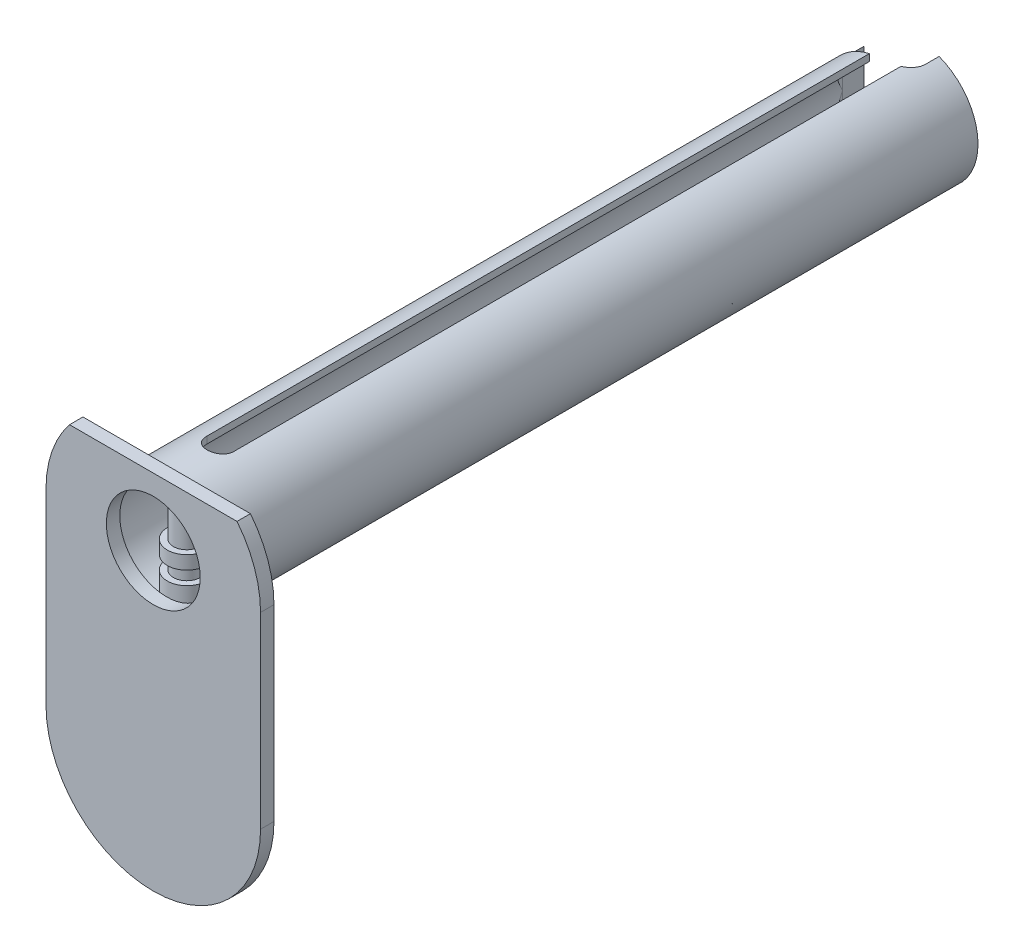
from build123d import *

# Parameters (mm, degrees)
ESQUISSE1_R                    = 4.5
ESQUISSE1_R_2                  = 4
BOSS_EXTRU_1_DEPTH             = 28
BOSS_EXTRU_2_REACH             = 30.714
ESQUISSE2_R                    = 1
ESQUISSE2_R_2                  = 0.5
BOSS_EXTRU_2_DIRECTION_2_REACH = 30.714
ENL_V_MAT_EXTRU_1_DEPTH        = 29.714108128
ENL_V_MAT_EXTRU_1_DEPTH_BACK   = 29.714108128
ESQUISSE4_R                    = 3.5
BOSS_EXTRU_3_DEPTH             = 1
ESQUISSE6_OUTSIDE_W            = 31.274
ESQUISSE6_OUTSIDE_H            = 45.274
ESQUISSE6_OUTSIDE_W_2          = 16
ESQUISSE6_OUTSIDE_H_2          = 27
ENL_V_MAT_EXTRU_2_DEPTH        = 62.619802105
BOSS_EXTRU_6_START             = -1.5
ESQUISSE7_R                    = 1.45
BOSS_EXTRU_6_DEPTH             = 1
BOSS_EXTRU_7_REACH             = 39.404
BOSS_EXTRU_7_START             = 1
ESQUISSE8_R                    = 1.45
ENL_V_MAT_EXTRU_3_DEPTH        = 38.269290307
ENL_V_MAT_EXTRU_3_DEPTH_BACK   = 38.269290307


with BuildPart() as part:
    # Esquisse1 → Boss.-Extru.1 (new, symmetric)
    with BuildSketch(Plane.XY):
        Circle(ESQUISSE1_R)
        Circle(ESQUISSE1_R_2, mode=Mode.SUBTRACT)
    extrude(amount=BOSS_EXTRU_1_DEPTH, both=True)

    # Esquisse2 → Boss.-Extru.2 (add, up to next)
    with BuildSketch(Plane(origin=(0, 0, 0), x_dir=(1, 0, 0), z_dir=(0, 1, 0)), mode=Mode.PRIVATE) as boss_extru_2_sk1:
        with Locations((0, -26.5)):
            Circle(ESQUISSE2_R)
    boss_extru_2_tool1 = extrude(boss_extru_2_sk1.sketch, amount=BOSS_EXTRU_2_REACH, mode=Mode.PRIVATE) - part.part
    # Esquisse2 → Boss.-Extru.2 (add, up to next)
    with BuildSketch(Plane(origin=(0, 0, 0), x_dir=(1, 0, 0), z_dir=(0, 1, 0)), mode=Mode.PRIVATE) as boss_extru_2_sk2:
        with Locations((3, 26.5)):
            Circle(ESQUISSE2_R_2)
    boss_extru_2_tool2 = extrude(boss_extru_2_sk2.sketch, amount=BOSS_EXTRU_2_REACH, mode=Mode.PRIVATE) - part.part
    add(boss_extru_2_tool1.solids().sort_by_distance((0, 0, 26.5))[0])
    add(boss_extru_2_tool2.solids().sort_by_distance((3, 0, -26.5))[0])

    # Esquisse2 → Boss.-Extru.2 direction 2 (add, up to next)
    with BuildSketch(Plane(origin=(0, 0, 0), x_dir=(1, 0, 0), z_dir=(0, 1, 0)), mode=Mode.PRIVATE) as boss_extru_2_direction_2_sk1:
        with Locations((0, -26.5)):
            Circle(ESQUISSE2_R)
    boss_extru_2_direction_2_tool1 = extrude(boss_extru_2_direction_2_sk1.sketch, amount=-BOSS_EXTRU_2_DIRECTION_2_REACH, mode=Mode.PRIVATE) - part.part
    # Esquisse2 → Boss.-Extru.2 direction 2 (add, up to next)
    with BuildSketch(Plane(origin=(0, 0, 0), x_dir=(1, 0, 0), z_dir=(0, 1, 0)), mode=Mode.PRIVATE) as boss_extru_2_direction_2_sk2:
        with Locations((3, 26.5)):
            Circle(ESQUISSE2_R_2)
    boss_extru_2_direction_2_tool2 = extrude(boss_extru_2_direction_2_sk2.sketch, amount=-BOSS_EXTRU_2_DIRECTION_2_REACH, mode=Mode.PRIVATE) - part.part
    add(boss_extru_2_direction_2_tool1.solids().sort_by_distance((0, 0, 26.5))[0])
    add(boss_extru_2_direction_2_tool2.solids().sort_by_distance((3, 0, -26.5))[0])

    # Esquisse3 → Enlèv. mat.-Extru.1 (cut, two sides: drawn at the far end of the back side and taken through both)
    with BuildSketch(Plane(origin=(0, 0, 0), x_dir=(1, 0, 0), z_dir=(0, 1, 0)).offset(-ENL_V_MAT_EXTRU_1_DEPTH_BACK)):
        with BuildLine():
            Line((1, 28), (1, -24))
            ThreePointArc((1, -24), (0, -25), (-1, -24))
            Line((-1, -24), (-1, 28))
            ThreePointArc((-1, 28), (0, 29), (1, 28))
        make_face()
    extrude(amount=ENL_V_MAT_EXTRU_1_DEPTH + ENL_V_MAT_EXTRU_1_DEPTH_BACK, mode=Mode.SUBTRACT)

    # Esquisse4 → Boss.-Extru.3 (add)
    with BuildSketch(Plane.XY.offset(28)):
        with BuildLine():
            Line((8, 0), (8, -14))
            ThreePointArc((8, -14), (0, -22), (-8, -14))
            Line((-8, -14), (-8, 0))
            ThreePointArc((-8, 0), (0, 8), (8, 0))
        make_face()
        Circle(ESQUISSE4_R, mode=Mode.SUBTRACT)
    extrude(amount=BOSS_EXTRU_3_DEPTH)

    # Esquisse6 outside → Enlèv. mat.-Extru.2 (cut, through all)
    with BuildSketch(Plane.XY.offset(29)):
        with Locations((0, -7)):
            Rectangle(ESQUISSE6_OUTSIDE_W, ESQUISSE6_OUTSIDE_H)
        with Locations((0, -8.5)):
            Rectangle(ESQUISSE6_OUTSIDE_W_2, ESQUISSE6_OUTSIDE_H_2, mode=Mode.SUBTRACT)
    extrude(amount=-ENL_V_MAT_EXTRU_2_DEPTH, mode=Mode.SUBTRACT)

    # Esquisse7 → Boss.-Extru.6 (add)
    with BuildSketch(Plane(origin=(0, 0, 0), x_dir=(1, 0, 0), z_dir=(0, 1, 0)).offset(BOSS_EXTRU_6_START)):
        with Locations((0, -26.5)):
            Circle(ESQUISSE7_R)
    extrude(amount=BOSS_EXTRU_6_DEPTH)

    # Esquisse8 → Boss.-Extru.7 (add, up to next)
    with BuildSketch(Plane.XZ.offset(1.5).offset(BOSS_EXTRU_7_START), mode=Mode.PRIVATE) as boss_extru_7_sk1:
        with Locations((0, 26.5)):
            Circle(ESQUISSE8_R)
    boss_extru_7_tool1 = extrude(boss_extru_7_sk1.sketch, amount=BOSS_EXTRU_7_REACH, mode=Mode.PRIVATE) - part.part
    add(boss_extru_7_tool1.solids().sort_by_distance((0, -2.5, 26.5))[0])

    # Esquisse9 → Enlèv. mat.-Extru.3 (cut, two sides: drawn at the far end of the back side and taken through both)
    with BuildSketch(Plane(origin=(0, 0, 0), x_dir=(1, 0, 0), z_dir=(0, 1, 0)).offset(-ENL_V_MAT_EXTRU_3_DEPTH_BACK)):
        with BuildLine():
            Line((0, 25.4), (-3, 25.4))
            ThreePointArc((-3, 25.4), (-3.707106781, 25.692893219), (-4, 26.4))
            Line((-4, 26.4), (-4, 28))
            Line((-4, 28), (1.6, 28))
            Line((1.6, 28), (1.6, 27))
            ThreePointArc((1.6, 27), (1.13137085, 25.86862915), (0, 25.4))
        make_face()
    extrude(amount=ENL_V_MAT_EXTRU_3_DEPTH + ENL_V_MAT_EXTRU_3_DEPTH_BACK, mode=Mode.SUBTRACT)


solid = part.part
